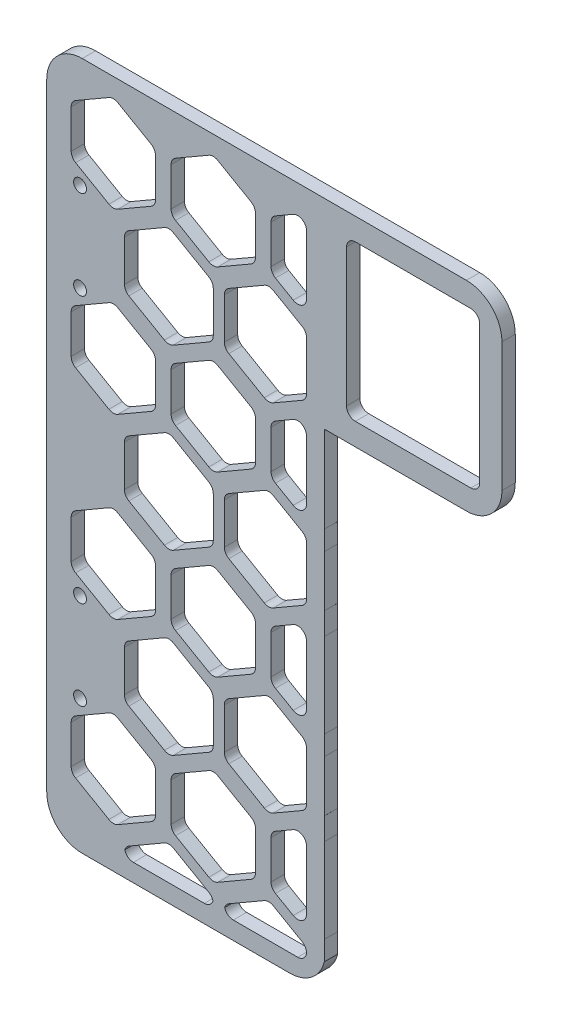
from build123d import *

# Parameters (mm, degrees)
SKETCH_1_W          = 62.5
SKETCH_1_H          = 155
SKETCH_1_R          = 1.45
EXTRUDE_1_DEPTH     = 3
CUT_EXTRUDE_1_DEPTH = 3
EXTRUDE_3_DEPTH     = 3
EXTRUDE_4_DEPTH     = 3
FILLET_1_R          = 8
FILLET_2_R          = 2


with BuildPart() as part:
    # 草图1 → 凸台-拉伸1 (new body)
    with BuildSketch(Plane.XY):
        with Locations((31.25, 77.5)):
            Rectangle(SKETCH_1_W, SKETCH_1_H)
        with Locations((7.5, 30)):
            Circle(SKETCH_1_R, mode=Mode.SUBTRACT)
        with Locations((7.5, 50)):
            Circle(SKETCH_1_R, mode=Mode.SUBTRACT)
        with Locations((7.5, 110)):
            Circle(SKETCH_1_R, mode=Mode.SUBTRACT)
        with Locations((7.5, 130)):
            Circle(SKETCH_1_R, mode=Mode.SUBTRACT)
    extrude(amount=EXTRUDE_1_DEPTH)

    # 草图3 → 切除-拉伸1 (cut)
    with BuildSketch(Plane.XY.offset(3)):
        Polygon((15, 150.969655115), (5.5, 145.484827557), (5.5, 134.515172443), (15, 129.030344885), (24.5, 134.515172443), (24.5, 145.484827557), align=None)
        Polygon((27.494515509, 131.863215266), (17.494515509, 126.089712575), (17.494515509, 114.542707191), (27.494515509, 108.769204499), (37.494515509, 114.542707191), (37.494515509, 126.089712575), align=None)
        Polygon((37.5, 150.969655115), (28, 145.484827557), (28, 134.515172443), (37.5, 129.030344885), (47, 134.515172443), (47, 145.484827557), align=None)
        Polygon((49.994515509, 131.863215266), (39.994515509, 126.089712575), (39.994515509, 114.542707191), (49.994515509, 108.769204499), (59.994515509, 114.542707191), (59.994515509, 126.089712575), align=None)
        Polygon((37.5, 110.969655115), (28, 105.484827557), (28, 94.515172443), (37.5, 89.030344885), (47, 94.515172443), (47, 105.484827557), align=None)
        Polygon((49.994515509, 91.863215266), (39.994515509, 86.089712575), (39.994515509, 74.542707191), (49.994515509, 68.769204499), (59.994515509, 74.542707191), (59.994515509, 86.089712575), align=None)
        Polygon((37.5, 70.969655115), (28, 65.484827557), (28, 54.515172443), (37.5, 49.030344885), (47, 54.515172443), (47, 65.484827557), align=None)
        Polygon((49.994515509, 51.863215266), (39.994515509, 46.089712575), (39.994515509, 34.542707191), (49.994515509, 28.769204499), (59.994515509, 34.542707191), (59.994515509, 46.089712575), align=None)
        Polygon((15, 110.969655115), (5.5, 105.484827557), (5.5, 94.515172443), (15, 89.030344885), (24.5, 94.515172443), (24.5, 105.484827557), align=None)
        Polygon((27.494515509, 91.863215266), (17.494515509, 86.089712575), (17.494515509, 74.542707191), (27.494515509, 68.769204499), (37.494515509, 74.542707191), (37.494515509, 86.089712575), align=None)
        Polygon((15, 70.969655115), (5.5, 65.484827557), (5.5, 54.515172443), (15, 49.030344885), (24.5, 54.515172443), (24.5, 65.484827557), align=None)
        Polygon((27.494515509, 51.863215266), (17.494515509, 46.089712575), (17.494515509, 34.542707191), (27.494515509, 28.769204499), (37.494515509, 34.542707191), (37.494515509, 46.089712575), align=None)
        Polygon((60, 150.969655115), (50.5, 145.484827557), (50.5, 134.515172443), (60, 129.030344885), (69.5, 134.515172443), (69.5, 145.484827557), align=None)
        Polygon((72.494515509, 131.863215266), (62.494515509, 126.089712575), (62.494515509, 114.542707191), (72.494515509, 108.769204499), (82.494515509, 114.542707191), (82.494515509, 126.089712575), align=None)
        Polygon((60, 110.969655115), (50.5, 105.484827557), (50.5, 94.515172443), (60, 89.030344885), (69.5, 94.515172443), (69.5, 105.484827557), align=None)
        Polygon((72.494515509, 91.863215266), (62.494515509, 86.089712575), (62.494515509, 74.542707191), (72.494515509, 68.769204499), (82.494515509, 74.542707191), (82.494515509, 86.089712575), align=None)
        Polygon((60, 70.969655115), (50.5, 65.484827557), (50.5, 54.515172443), (60, 49.030344885), (69.5, 54.515172443), (69.5, 65.484827557), align=None)
        Polygon((72.494515509, 51.863215266), (62.494515509, 46.089712575), (62.494515509, 34.542707191), (72.494515509, 28.769204499), (82.494515509, 34.542707191), (82.494515509, 46.089712575), align=None)
        Polygon((15, 30.969655115), (5.5, 25.484827557), (5.5, 14.515172443), (15, 9.030344885), (24.5, 14.515172443), (24.5, 25.484827557), align=None)
        Polygon((27.494515509, 11.863215266), (17.494515509, 6.089712575), (17.494515509, -5.457292809), (27.494515509, -11.230795501), (37.494515509, -5.457292809), (37.494515509, 6.089712575), align=None)
        Polygon((37.5, 30.969655115), (28, 25.484827557), (28, 14.515172443), (37.5, 9.030344885), (47, 14.515172443), (47, 25.484827557), align=None)
        Polygon((49.994515509, 11.863215266), (39.994515509, 6.089712575), (39.994515509, -5.457292809), (49.994515509, -11.230795501), (59.994515509, -5.457292809), (59.994515509, 6.089712575), align=None)
        Polygon((60, 30.969655115), (50.5, 25.484827557), (50.5, 14.515172443), (60, 9.030344885), (69.5, 14.515172443), (69.5, 25.484827557), align=None)
        Polygon((72.494515509, 11.863215266), (62.494515509, 6.089712575), (62.494515509, -5.457292809), (72.494515509, -11.230795501), (82.494515509, -5.457292809), (82.494515509, 6.089712575), align=None)
    extrude(amount=-CUT_EXTRUDE_1_DEPTH, mode=Mode.SUBTRACT)

    # 草图5 → 凸台-拉伸3 (add)
    with BuildSketch(Plane.XY.offset(3)):
        Polygon((62.5, 155), (62.494515509, 0), (8.747257755, 0), (8.747257755, 4), (58.5, 4), (58.5, 155), align=None)
    extrude(amount=-EXTRUDE_3_DEPTH)

    # 草图6 → 凸台-拉伸4 (add)
    with BuildSketch(Plane.XY):
        Polygon((62.5, 155), (102.498407729, 155), (102.498407729, 110), (62.498407729, 110), align=None)
        Polygon((67.498584651, 115), (67.499823084, 150), (97.498407729, 150), (97.498407729, 115), align=None, mode=Mode.SUBTRACT)
    extrude(amount=EXTRUDE_4_DEPTH)

    # 圆角1
    # the kernel refuses this fillet: 8 mm, written as the material it takes off along each edge
    with BuildSketch(Plane(origin=(62.494515509, 0, -19.420982421), x_dir=(-1, 0, 0), z_dir=(0, 0, 1))) as fillet_1_piece_1:
        with BuildLine():
            CenterArc((7.768392968, -8), FILLET_1_R, 90, 76.186021606)
            Line((-0.000215482, -6.089836983), (-0.155587651, -6.051633723))
            ThreePointArc((-0.155587651, -6.051633723), (-0.160107741, -3.04491283), (-0.16, 5.661e-06))
            Line((-0.16, 5.661e-06), (0, 0.16))
            Line((0, 0.16), (7.768392968, 0.16))
            Line((7.768392968, 0.16), (7.768392968, 0))
        make_face()
    extrude(amount=41.841964841, mode=Mode.SUBTRACT)
    with BuildSketch(Plane(origin=(0, 0, -20), x_dir=(1, 0, 0), z_dir=(0, 0, 1))) as fillet_1_piece_2:
        with BuildLine():
            CenterArc((FILLET_1_R, FILLET_1_R), FILLET_1_R, 180, 90)
            Line((0, FILLET_1_R), (-FILLET_1_R * 0.02, FILLET_1_R))
            Line((-FILLET_1_R * 0.02, FILLET_1_R), (-FILLET_1_R * 0.02, -FILLET_1_R * 0.02))
            Line((-FILLET_1_R * 0.02, -FILLET_1_R * 0.02), (FILLET_1_R, -FILLET_1_R * 0.02))
            Line((FILLET_1_R, -FILLET_1_R * 0.02), (FILLET_1_R, 0))
        make_face()
    extrude(amount=43, mode=Mode.SUBTRACT)
    with BuildSketch(Plane(origin=(0, 155, -20), x_dir=(1, 0, 0), z_dir=(0, 0, 1)), Plane(origin=(102.498407729, 155, -20), x_dir=(0, -1, 0), z_dir=(0, 0, 1)), Plane(origin=(102.498407729, 110, -20), x_dir=(-1, 0, 0), z_dir=(0, 0, 1))) as fillet_1_piece_3:
        with BuildLine():
            CenterArc((FILLET_1_R, -FILLET_1_R), FILLET_1_R, 90, 90)
            Line((0, -FILLET_1_R), (-FILLET_1_R * 0.02, -FILLET_1_R))
            Line((-FILLET_1_R * 0.02, -FILLET_1_R), (-FILLET_1_R * 0.02, FILLET_1_R * 0.02))
            Line((-FILLET_1_R * 0.02, FILLET_1_R * 0.02), (FILLET_1_R, FILLET_1_R * 0.02))
            Line((FILLET_1_R, FILLET_1_R * 0.02), (FILLET_1_R, 0))
        make_face()
    extrude(amount=43, mode=Mode.SUBTRACT)

    # 圆角2
    # the kernel refuses this fillet: 2 mm, written as the material it adds along each edge
    with BuildSketch(Plane(origin=(50.5, 134.515172443, 3), x_dir=(0, 1, 0), z_dir=(0, 0, -1)), Plane(origin=(50.5, 145.484827557, 3), x_dir=(0.8660254037844353, 0.500000000000006, 0), z_dir=(0, 0, -1)), Plane(origin=(27.494515509, 28.769204499, 3), x_dir=(-0.8660254037844385, 0.5000000000000003, 0), z_dir=(0, 0, -1)), Plane(origin=(17.494515509, 34.542707191, 3), x_dir=(0, 1, 0), z_dir=(0, 0, -1)), Plane(origin=(17.494515509, 46.089712575, 3), x_dir=(0.8660254037844382, 0.5000000000000006, 0), z_dir=(0, 0, -1)), Plane(origin=(27.494515509, 68.769204499, 3), x_dir=(-0.8660254037844392, 0.49999999999999933, 0), z_dir=(0, 0, -1)), Plane(origin=(17.494515509, 74.542707191, 3), x_dir=(0, 1, 0), z_dir=(0, 0, -1)), Plane(origin=(17.494515509, 86.089712575, 3), x_dir=(0.8660254037844375, 0.5000000000000019, 0), z_dir=(0, 0, -1)), Plane(origin=(15, 49.030344885, 3), x_dir=(-0.8660254037844398, 0.499999999999998, 0), z_dir=(0, 0, -1)), Plane(origin=(5.5, 54.515172443, 3), x_dir=(0, 1, 0), z_dir=(0, 0, -1)), Plane(origin=(5.5, 65.484827557, 3), x_dir=(0.8660254037844403, 0.49999999999999734, 0), z_dir=(0, 0, -1)), Plane(origin=(50.5, 54.515172443, 3), x_dir=(0, 1, 0), z_dir=(0, 0, -1)), Plane(origin=(50.5, 65.484827557, 3), x_dir=(0.8660254037844382, 0.5000000000000006, 0), z_dir=(0, 0, -1)), Plane(origin=(50.5, 94.515172443, 3), x_dir=(0, 1, 0), z_dir=(0, 0, -1)), Plane(origin=(50.5, 105.484827557, 3), x_dir=(0.8660254037844367, 0.5000000000000032, 0), z_dir=(0, 0, -1)), Plane(origin=(49.994515509, 131.863215266, 3), x_dir=(0.8660254037844414, -0.4999999999999953, 0), z_dir=(0, 0, -1)), Plane(origin=(39.994515509, 114.542707191, 3), x_dir=(0, 1, 0), z_dir=(0, 0, -1)), Plane(origin=(39.994515509, 126.089712575, 3), x_dir=(0.8660254037844375, 0.5000000000000018, 0), z_dir=(0, 0, -1)), Plane(origin=(37.5, 89.030344885, 3), x_dir=(-0.8660254037844398, 0.499999999999998, 0), z_dir=(0, 0, -1)), Plane(origin=(28, 94.515172443, 3), x_dir=(0, 1, 0), z_dir=(0, 0, -1)), Plane(origin=(28, 105.484827557, 3), x_dir=(0.8660254037844421, 0.49999999999999395, 0), z_dir=(0, 0, -1)), Plane(origin=(27.494515509, 108.769204499, 3), x_dir=(-0.8660254037844392, 0.49999999999999933, 0), z_dir=(0, 0, -1)), Plane(origin=(17.494515509, 114.542707191, 3), x_dir=(0, 1, 0), z_dir=(0, 0, -1)), Plane(origin=(17.494515509, 126.089712575, 3), x_dir=(0.8660254037844414, 0.4999999999999953, 0), z_dir=(0, 0, -1)), Plane(origin=(37.5, 129.030344885, 3), x_dir=(-0.8660254037844414, 0.4999999999999953, 0), z_dir=(0, 0, -1)), Plane(origin=(28, 134.515172443, 3), x_dir=(0, 1, 0), z_dir=(0, 0, -1)), Plane(origin=(28, 145.484827557, 3), x_dir=(0.8660254037844353, 0.500000000000006, 0), z_dir=(0, 0, -1)), Plane(origin=(15, 89.030344885, 3), x_dir=(-0.8660254037844387, 0.5, 0), z_dir=(0, 0, -1)), Plane(origin=(5.5, 94.515172443, 3), x_dir=(0, 1, 0), z_dir=(0, 0, -1)), Plane(origin=(5.5, 105.484827557, 3), x_dir=(0.8660254037844404, 0.49999999999999695, 0), z_dir=(0, 0, -1)), Plane(origin=(49.994515509, 51.863215266, 3), x_dir=(0.8660254037844398, -0.499999999999998, 0), z_dir=(0, 0, -1)), Plane(origin=(39.994515509, 34.542707191, 3), x_dir=(0, 1, 0), z_dir=(0, 0, -1)), Plane(origin=(39.994515509, 46.089712575, 3), x_dir=(0.8660254037844372, 0.5000000000000026, 0), z_dir=(0, 0, -1)), Plane(origin=(49.994515509, 91.863215266, 3), x_dir=(0.8660254037844398, -0.499999999999998, 0), z_dir=(0, 0, -1)), Plane(origin=(39.994515509, 74.542707191, 3), x_dir=(0, 1, 0), z_dir=(0, 0, -1)), Plane(origin=(39.994515509, 86.089712575, 3), x_dir=(0.8660254037844382, 0.5000000000000006, 0), z_dir=(0, 0, -1)), Plane(origin=(37.5, 49.030344885, 3), x_dir=(-0.8660254037844372, 0.5000000000000026, 0), z_dir=(0, 0, -1)), Plane(origin=(28, 54.515172443, 3), x_dir=(0, 1, 0), z_dir=(0, 0, -1)), Plane(origin=(28, 65.484827557, 3), x_dir=(0.8660254037844398, 0.499999999999998, 0), z_dir=(0, 0, -1)), Plane(origin=(50.5, 14.515172443, 3), x_dir=(0, 1, 0), z_dir=(0, 0, -1)), Plane(origin=(50.5, 25.484827557, 3), x_dir=(0.8660254037844382, 0.5000000000000006, 0), z_dir=(0, 0, -1)), Plane(origin=(49.994515509, 11.863215266, 3), x_dir=(0.8660254037844377, -0.5000000000000018, 0), z_dir=(0, 0, -1)), Plane(origin=(39.994515509, 6.089712575, 3), x_dir=(0.8660254037844385, 0.5000000000000003, 0), z_dir=(0, 0, -1)), Plane(origin=(15, 9.030344885, 3), x_dir=(-0.8660254037844389, 0.4999999999999996, 0), z_dir=(0, 0, -1)), Plane(origin=(5.5, 14.515172443, 3), x_dir=(0, 1, 0), z_dir=(0, 0, -1)), Plane(origin=(5.5, 25.484827557, 3), x_dir=(0.8660254037844389, 0.4999999999999996, 0), z_dir=(0, 0, -1)), Plane(origin=(37.5, 9.030344885, 3), x_dir=(-0.8660254037844392, 0.4999999999999991, 0), z_dir=(0, 0, -1)), Plane(origin=(28, 14.515172443, 3), x_dir=(0, 1, 0), z_dir=(0, 0, -1)), Plane(origin=(28, 25.484827557, 3), x_dir=(0.8660254037844392, 0.49999999999999933, 0), z_dir=(0, 0, -1)), Plane(origin=(37.494515509, 6.089712575, 3), x_dir=(0, -1, 0), z_dir=(0, 0, -1)), Plane(origin=(27.494515509, 11.863215266, 3), x_dir=(0.8660254037844378, -0.5000000000000014, 0), z_dir=(0, 0, -1)), Plane(origin=(15, 129.030344885, 3), x_dir=(-0.8660254037844409, 0.49999999999999595, 0), z_dir=(0, 0, -1)), Plane(origin=(5.5, 134.515172443, 3), x_dir=(0, 1, 0), z_dir=(0, 0, -1)), Plane(origin=(5.5, 145.484827557, 3), x_dir=(0.8660254037844375, 0.5000000000000019, 0), z_dir=(0, 0, -1)), Plane(origin=(58.5, 113.679848259, 0), x_dir=(0, 1, 0), z_dir=(0, 0, 1)), Plane(origin=(58.5, 73.679848259, 0), x_dir=(0, 1, 0), z_dir=(0, 0, 1)), Plane(origin=(58.5, 33.679848259, 0), x_dir=(0, 1, 0), z_dir=(0, 0, 1))) as fillet_2_piece_1:
        with BuildLine():
            CenterArc((FILLET_2_R * 0.57735026919, FILLET_2_R), FILLET_2_R, 210, 60)
            Line((-FILLET_2_R * 0.288675134595, FILLET_2_R * 0.5), (0, 0))
            Line((0, 0), (FILLET_2_R * 0.57735026919, 0))
        make_face()
    extrude(amount=3)
    with BuildSketch(Plane(origin=(27.494515509, 51.863215266, 3), x_dir=(-0.8660254037844387, -0.4999999999999999, 0), z_dir=(0, 0, -1)), Plane(origin=(37.494515509, 46.089712575, 3), x_dir=(-0.8660254037844372, 0.5000000000000026, 0), z_dir=(0, 0, -1)), Plane(origin=(37.494515509, 34.542707191, 3), x_dir=(0, 1, 0), z_dir=(0, 0, -1)), Plane(origin=(27.494515509, 91.863215266, 3), x_dir=(-0.866025403784436, -0.5000000000000046, 0), z_dir=(0, 0, -1)), Plane(origin=(37.494515509, 86.089712575, 3), x_dir=(-0.8660254037844398, 0.499999999999998, 0), z_dir=(0, 0, -1)), Plane(origin=(37.494515509, 74.542707191, 3), x_dir=(0, 1, 0), z_dir=(0, 0, -1)), Plane(origin=(15, 70.969655115, 3), x_dir=(-0.8660254037844382, -0.5000000000000006, 0), z_dir=(0, 0, -1)), Plane(origin=(24.5, 65.484827557, 3), x_dir=(-0.8660254037844398, 0.499999999999998, 0), z_dir=(0, 0, -1)), Plane(origin=(24.5, 54.515172443, 3), x_dir=(0, 1, 0), z_dir=(0, 0, -1)), Plane(origin=(49.994515509, 108.769204499, 3), x_dir=(0.8660254037844382, 0.5000000000000006, 0), z_dir=(0, 0, -1)), Plane(origin=(37.5, 110.969655115, 3), x_dir=(-0.8660254037844382, -0.5000000000000006, 0), z_dir=(0, 0, -1)), Plane(origin=(47, 105.484827557, 3), x_dir=(-0.8660254037844398, 0.499999999999998, 0), z_dir=(0, 0, -1)), Plane(origin=(47, 94.515172443, 3), x_dir=(0, 1, 0), z_dir=(0, 0, -1)), Plane(origin=(27.494515509, 131.863215266, 3), x_dir=(-0.8660254037844392, -0.49999999999999933, 0), z_dir=(0, 0, -1)), Plane(origin=(37.494515509, 126.089712575, 3), x_dir=(-0.8660254037844398, 0.499999999999998, 0), z_dir=(0, 0, -1)), Plane(origin=(37.494515509, 114.542707191, 3), x_dir=(0, 1, 0), z_dir=(0, 0, -1)), Plane(origin=(37.5, 150.969655115, 3), x_dir=(-0.8660254037844428, -0.4999999999999926, 0), z_dir=(0, 0, -1)), Plane(origin=(47, 145.484827557, 3), x_dir=(-0.8660254037844382, 0.5000000000000006, 0), z_dir=(0, 0, -1)), Plane(origin=(47, 134.515172443, 3), x_dir=(0, 1, 0), z_dir=(0, 0, -1)), Plane(origin=(15, 110.969655115, 3), x_dir=(-0.8660254037844382, -0.5000000000000006, 0), z_dir=(0, 0, -1)), Plane(origin=(24.5, 105.484827557, 3), x_dir=(-0.8660254037844406, 0.4999999999999966, 0), z_dir=(0, 0, -1)), Plane(origin=(24.5, 94.515172443, 3), x_dir=(0, 1, 0), z_dir=(0, 0, -1)), Plane(origin=(49.994515509, 28.769204499, 3), x_dir=(0.8660254037844385, 0.5000000000000003, 0), z_dir=(0, 0, -1)), Plane(origin=(49.994515509, 68.769204499, 3), x_dir=(0.8660254037844382, 0.5000000000000006, 0), z_dir=(0, 0, -1)), Plane(origin=(37.5, 70.969655115, 3), x_dir=(-0.8660254037844414, -0.4999999999999953, 0), z_dir=(0, 0, -1)), Plane(origin=(47, 65.484827557, 3), x_dir=(-0.8660254037844398, 0.499999999999998, 0), z_dir=(0, 0, -1)), Plane(origin=(47, 54.515172443, 3), x_dir=(0, 1, 0), z_dir=(0, 0, -1)), Plane(origin=(15, 30.969655115, 3), x_dir=(-0.8660254037844389, -0.4999999999999996, 0), z_dir=(0, 0, -1)), Plane(origin=(24.5, 25.484827557, 3), x_dir=(-0.8660254037844393, 0.49999999999999895, 0), z_dir=(0, 0, -1)), Plane(origin=(24.5, 14.515172443, 3), x_dir=(0, 1, 0), z_dir=(0, 0, -1)), Plane(origin=(37.5, 30.969655115, 3), x_dir=(-0.8660254037844385, -0.5000000000000003, 0), z_dir=(0, 0, -1)), Plane(origin=(47, 25.484827557, 3), x_dir=(-0.8660254037844382, 0.5000000000000006, 0), z_dir=(0, 0, -1)), Plane(origin=(47, 14.515172443, 3), x_dir=(0, 1, 0), z_dir=(0, 0, -1)), Plane(origin=(17.494515509, 6.089712575, 3), x_dir=(0, -1, 0), z_dir=(0, 0, -1)), Plane(origin=(15, 150.969655115, 3), x_dir=(-0.8660254037844425, -0.4999999999999933, 0), z_dir=(0, 0, -1)), Plane(origin=(24.5, 145.484827557, 3), x_dir=(-0.8660254037844392, 0.49999999999999933, 0), z_dir=(0, 0, -1)), Plane(origin=(24.5, 134.515172443, 3), x_dir=(0, 1, 0), z_dir=(0, 0, -1)), Plane(origin=(58.5, 6.952571506, 3), x_dir=(-0.8660254037844394, 0.4999999999999987, 0), z_dir=(0, 0, -1)), Plane(origin=(58.5, 86.952571506, 3), x_dir=(-0.8660254037844398, 0.499999999999998, 0), z_dir=(0, 0, -1)), Plane(origin=(58.5, 46.952571506, 3), x_dir=(-0.8660254037844467, 0.49999999999998607, 0), z_dir=(0, 0, -1)), Plane(origin=(58.5, 126.952571506, 3), x_dir=(-0.8660254037844328, 0.5000000000000098, 0), z_dir=(0, 0, -1))) as fillet_2_piece_2:
        with BuildLine():
            CenterArc((FILLET_2_R * 0.57735026919, -FILLET_2_R), FILLET_2_R, 90, 60)
            Line((-FILLET_2_R * 0.288675134595, -FILLET_2_R * 0.5), (0, 0))
            Line((0, 0), (FILLET_2_R * 0.57735026919, 0))
        make_face()
    extrude(amount=3)
    with BuildSketch(Plane(origin=(39.994515509, 4, 0), x_dir=(1, 0, 0), z_dir=(0, 0, 1)), Plane(origin=(17.494515509, 4, 0), x_dir=(1, 0, 0), z_dir=(0, 0, 1)), Plane(origin=(97.498407729, 115, 0), x_dir=(0, 1, 0), z_dir=(0, 0, 1))) as fillet_2_piece_3:
        with BuildLine():
            CenterArc((FILLET_2_R, FILLET_2_R), FILLET_2_R, 180, 90)
            Line((0, FILLET_2_R), (0, 0))
            Line((0, 0), (FILLET_2_R, 0))
        make_face()
    extrude(amount=3)
    with BuildSketch(Plane(origin=(37.494515509, 4, 3), x_dir=(0, 1, 0), z_dir=(0, 0, -1)), Plane(origin=(58.5, 4, 3), x_dir=(0, 1, 0), z_dir=(0, 0, -1)), Plane(origin=(97.498407729, 150, 0), x_dir=(0, -1, 0), z_dir=(0, 0, 1))) as fillet_2_piece_4:
        with BuildLine():
            CenterArc((FILLET_2_R, -FILLET_2_R), FILLET_2_R, 90, 90)
            Line((0, -FILLET_2_R), (0, 0))
            Line((0, 0), (FILLET_2_R, 0))
        make_face()
    extrude(amount=3)
    with BuildSketch(Plane(origin=(58.5, 9.896370289, 0), x_dir=(0, 1, 0), z_dir=(0, 0, 1)), Plane(origin=(58.5, 89.896370289, 0), x_dir=(0, 1, 0), z_dir=(0, 0, 1)), Plane(origin=(58.5, 49.896370289, 0), x_dir=(0, 1, 0), z_dir=(0, 0, 1)), Plane(origin=(58.5, 129.896370289, 0), x_dir=(0, 1, 0), z_dir=(0, 0, 1))) as fillet_2_piece_5:
        with BuildLine():
            CenterArc((FILLET_2_R * 1.73205080757, FILLET_2_R), FILLET_2_R, 150, 120)
            Line((FILLET_2_R * 0.866025403784, FILLET_2_R * 1.5), (0, 0))
            Line((0, 0), (FILLET_2_R * 1.73205080757, 0))
        make_face()
    extrude(amount=3)
    with BuildSketch(Plane(origin=(58.5, 110.103629711, 3), x_dir=(-0.8660254037844353, -0.5000000000000059, 0), z_dir=(0, 0, -1)), Plane(origin=(58.5, 70.103629711, 3), x_dir=(-0.8660254037844388, -0.4999999999999997, 0), z_dir=(0, 0, -1)), Plane(origin=(58.5, 150.103629711, 3), x_dir=(-0.8660254037844408, -0.49999999999999617, 0), z_dir=(0, 0, -1)), Plane(origin=(58.5, 30.103629711, 3), x_dir=(-0.8660254037844395, -0.49999999999999867, 0), z_dir=(0, 0, -1))) as fillet_2_piece_6:
        with BuildLine():
            CenterArc((FILLET_2_R * 1.73205080757, -FILLET_2_R), FILLET_2_R, 90, 120)
            Line((FILLET_2_R * 0.866025403784, -FILLET_2_R * 1.5), (0, 0))
            Line((0, 0), (FILLET_2_R * 1.73205080757, 0))
        make_face()
    extrude(amount=3)
    with BuildSketch(Plane(origin=(67.499823084, 150, 0), x_dir=(1, 0, 0), z_dir=(0, 0, 1))) as fillet_2_piece_7:
        with BuildLine():
            CenterArc((FILLET_2_R * 0.999964616815, -FILLET_2_R), FILLET_2_R, 90, 89.997972657)
            Line((-FILLET_2_R * 3.53825589627e-05, -FILLET_2_R * 0.999964616189), (0, 0))
            Line((0, 0), (FILLET_2_R * 0.999964616815, 0))
        make_face()
    extrude(amount=3)
    with BuildSketch(Plane(origin=(67.498584651, 115, 0), x_dir=(1, 0, 0), z_dir=(0, 0, 1))) as fillet_2_piece_8:
        with BuildLine():
            CenterArc((FILLET_2_R * 1.00003538444, FILLET_2_R), FILLET_2_R, 179.997972657, 90.002027343)
            Line((FILLET_2_R * 3.53850630006e-05, FILLET_2_R * 1.00003538381), (0, 0))
            Line((0, 0), (FILLET_2_R * 1.00003538444, 0))
        make_face()
    extrude(amount=3)


solid = part.part
